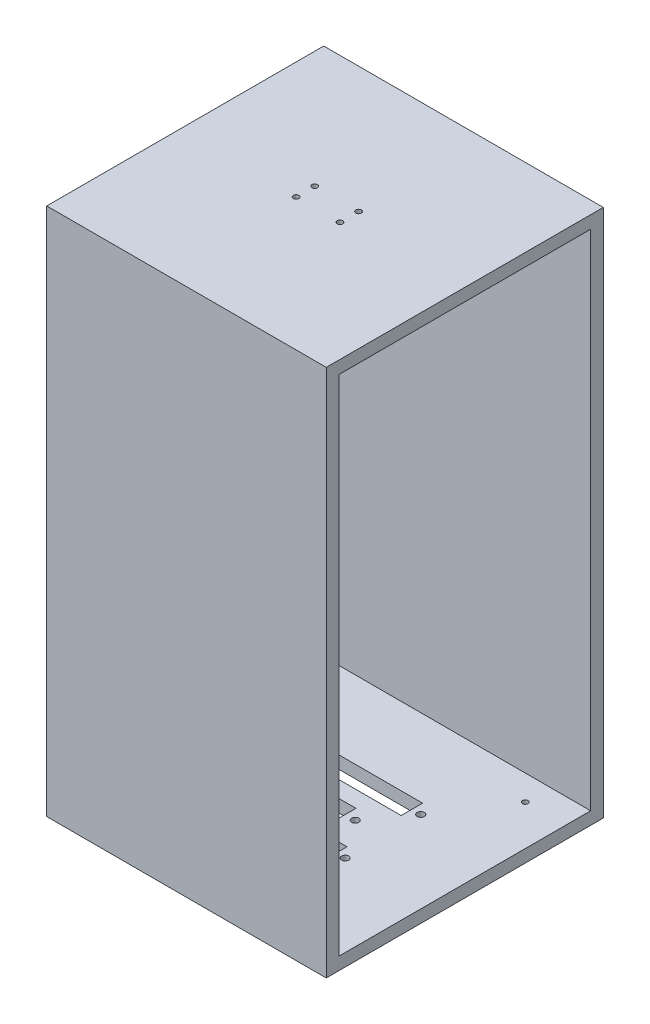
from build123d import *

# Parameters (mm, degrees)
SKETCH1_W             = 111
SKETCH1_H             = 110
MAIN_BODY_DEPTH       = 210
HOLLOW_INSIDE_T       = -5
MAIN_PCB_HOLES_REACH  = 226.19
SKETCH2_R             = 1.1
LED_PCB_HOLES_REACH   = 226.19
SKETCH3_R             = 1.1
CONNECTOR_SLOTS_REACH = 226.19
SKETCH4_R             = 1.4224
SKETCH4_W             = 17.1
SKETCH4_H             = 8.5
SKETCH4_W_2           = 40


with BuildPart() as part:
    # Sketch1 → Main-Body (new body)
    with BuildSketch(Plane(origin=(0, 0, 0), x_dir=(1, 0, 0), z_dir=(0, 1, 0))):
        with Locations((0.5, 0)):
            Rectangle(SKETCH1_W, SKETCH1_H)
    extrude(amount=MAIN_BODY_DEPTH)

    # Hollow-Inside
    hollow_inside_openings = [part.faces().sort_by_distance(p)[0] for p in [
        (56, 105, 0),
    ]]
    offset(amount=HOLLOW_INSIDE_T, openings=hollow_inside_openings, kind=Kind.INTERSECTION)

    # Sketch2 → Main-PCB-Holes (cut, up to next)
    with BuildSketch(Plane.XZ, mode=Mode.PRIVATE) as main_pcb_holes_sk1:
        with Locations((-40, 40)):
            Circle(SKETCH2_R)
    main_pcb_holes_tool1 = extrude(main_pcb_holes_sk1.sketch, amount=-MAIN_PCB_HOLES_REACH, mode=Mode.PRIVATE) & part.part
    # Sketch2 → Main-PCB-Holes (cut, up to next)
    with BuildSketch(Plane.XZ, mode=Mode.PRIVATE) as main_pcb_holes_sk2:
        with Locations((40, 40)):
            Circle(SKETCH2_R)
    main_pcb_holes_tool2 = extrude(main_pcb_holes_sk2.sketch, amount=-MAIN_PCB_HOLES_REACH, mode=Mode.PRIVATE) & part.part
    # Sketch2 → Main-PCB-Holes (cut, up to next)
    with BuildSketch(Plane.XZ, mode=Mode.PRIVATE) as main_pcb_holes_sk3:
        with Locations((40, -40)):
            Circle(SKETCH2_R)
    main_pcb_holes_tool3 = extrude(main_pcb_holes_sk3.sketch, amount=-MAIN_PCB_HOLES_REACH, mode=Mode.PRIVATE) & part.part
    # Sketch2 → Main-PCB-Holes (cut, up to next)
    with BuildSketch(Plane.XZ, mode=Mode.PRIVATE) as main_pcb_holes_sk4:
        with Locations((-40, -40)):
            Circle(SKETCH2_R)
    main_pcb_holes_tool4 = extrude(main_pcb_holes_sk4.sketch, amount=-MAIN_PCB_HOLES_REACH, mode=Mode.PRIVATE) & part.part
    add(main_pcb_holes_tool1.solids().sort_by_distance((-40, 0, 40))[0], mode=Mode.SUBTRACT)
    add(main_pcb_holes_tool2.solids().sort_by_distance((40, 0, 40))[0], mode=Mode.SUBTRACT)
    add(main_pcb_holes_tool3.solids().sort_by_distance((40, 0, -40))[0], mode=Mode.SUBTRACT)
    add(main_pcb_holes_tool4.solids().sort_by_distance((-40, 0, -40))[0], mode=Mode.SUBTRACT)

    # Sketch3 → LED-PCB-Holes (cut, up to next)
    with BuildSketch(Plane(origin=(0, 210, 0), x_dir=(1, 0, 0), z_dir=(0, 1, 0)), mode=Mode.PRIVATE) as led_pcb_holes_sk1:
        with Locations((-8.58, 5)):
            Circle(SKETCH3_R)
    led_pcb_holes_tool1 = extrude(led_pcb_holes_sk1.sketch, amount=-LED_PCB_HOLES_REACH, mode=Mode.PRIVATE) & part.part
    # Sketch3 → LED-PCB-Holes (cut, up to next)
    with BuildSketch(Plane(origin=(0, 210, 0), x_dir=(1, 0, 0), z_dir=(0, 1, 0)), mode=Mode.PRIVATE) as led_pcb_holes_sk2:
        with Locations((8.829, 5)):
            Circle(SKETCH3_R)
    led_pcb_holes_tool2 = extrude(led_pcb_holes_sk2.sketch, amount=-LED_PCB_HOLES_REACH, mode=Mode.PRIVATE) & part.part
    # Sketch3 → LED-PCB-Holes (cut, up to next)
    with BuildSketch(Plane(origin=(0, 210, 0), x_dir=(1, 0, 0), z_dir=(0, 1, 0)), mode=Mode.PRIVATE) as led_pcb_holes_sk3:
        with Locations((8.829, -2.4)):
            Circle(SKETCH3_R)
    led_pcb_holes_tool3 = extrude(led_pcb_holes_sk3.sketch, amount=-LED_PCB_HOLES_REACH, mode=Mode.PRIVATE) & part.part
    # Sketch3 → LED-PCB-Holes (cut, up to next)
    with BuildSketch(Plane(origin=(0, 210, 0), x_dir=(1, 0, 0), z_dir=(0, 1, 0)), mode=Mode.PRIVATE) as led_pcb_holes_sk4:
        with Locations((-8.58, -2.4)):
            Circle(SKETCH3_R)
    led_pcb_holes_tool4 = extrude(led_pcb_holes_sk4.sketch, amount=-LED_PCB_HOLES_REACH, mode=Mode.PRIVATE) & part.part
    add(led_pcb_holes_tool1.solids().sort_by_distance((-8.58, 210, -5))[0], mode=Mode.SUBTRACT)
    add(led_pcb_holes_tool2.solids().sort_by_distance((8.829, 210, -5))[0], mode=Mode.SUBTRACT)
    add(led_pcb_holes_tool3.solids().sort_by_distance((8.829, 210, 2.4))[0], mode=Mode.SUBTRACT)
    add(led_pcb_holes_tool4.solids().sort_by_distance((-8.58, 210, 2.4))[0], mode=Mode.SUBTRACT)

    # Sketch4 → Connector-Slots (cut, up to next)
    with BuildSketch(Plane.XZ, mode=Mode.PRIVATE) as connector_slots_sk1:
        with Locations((-12.4968, 0)):
            Circle(SKETCH4_R)
    connector_slots_tool1 = extrude(connector_slots_sk1.sketch, amount=-CONNECTOR_SLOTS_REACH, mode=Mode.PRIVATE) & part.part
    # Sketch4 → Connector-Slots (cut, up to next)
    with BuildSketch(Plane.XZ, mode=Mode.PRIVATE) as connector_slots_sk2:
        with Locations((12.4968, 0)):
            Circle(SKETCH4_R)
    connector_slots_tool2 = extrude(connector_slots_sk2.sketch, amount=-CONNECTOR_SLOTS_REACH, mode=Mode.PRIVATE) & part.part
    # Sketch4 → Connector-Slots (cut, up to next)
    with BuildSketch(Plane.XZ, mode=Mode.PRIVATE) as connector_slots_sk3:
        with Locations((-23.52, -15)):
            Circle(SKETCH4_R)
    connector_slots_tool3 = extrude(connector_slots_sk3.sketch, amount=-CONNECTOR_SLOTS_REACH, mode=Mode.PRIVATE) & part.part
    # Sketch4 → Connector-Slots (cut, up to next)
    with BuildSketch(Plane.XZ, mode=Mode.PRIVATE) as connector_slots_sk4:
        with Locations((23.52, -15)):
            Circle(SKETCH4_R)
    connector_slots_tool4 = extrude(connector_slots_sk4.sketch, amount=-CONNECTOR_SLOTS_REACH, mode=Mode.PRIVATE) & part.part
    # Sketch4 → Connector-Slots (cut, up to next)
    with BuildSketch(Plane.XZ, mode=Mode.PRIVATE) as connector_slots_sk5:
        with Locations((-23.52, 15)):
            Circle(SKETCH4_R)
    connector_slots_tool5 = extrude(connector_slots_sk5.sketch, amount=-CONNECTOR_SLOTS_REACH, mode=Mode.PRIVATE) & part.part
    # Sketch4 → Connector-Slots (cut, up to next)
    with BuildSketch(Plane.XZ, mode=Mode.PRIVATE) as connector_slots_sk6:
        with Locations((23.52, 15)):
            Circle(SKETCH4_R)
    connector_slots_tool6 = extrude(connector_slots_sk6.sketch, amount=-CONNECTOR_SLOTS_REACH, mode=Mode.PRIVATE) & part.part
    # Sketch4 → Connector-Slots (cut, up to next)
    with BuildSketch(Plane.XZ, mode=Mode.PRIVATE) as connector_slots_sk7:
        Rectangle(SKETCH4_W, SKETCH4_H)
    connector_slots_tool7 = extrude(connector_slots_sk7.sketch, amount=-CONNECTOR_SLOTS_REACH, mode=Mode.PRIVATE) & part.part
    # Sketch4 → Connector-Slots (cut, up to next)
    with BuildSketch(Plane.XZ, mode=Mode.PRIVATE) as connector_slots_sk8:
        with Locations((0, -15)):
            Rectangle(SKETCH4_W_2, SKETCH4_H)
    connector_slots_tool8 = extrude(connector_slots_sk8.sketch, amount=-CONNECTOR_SLOTS_REACH, mode=Mode.PRIVATE) & part.part
    # Sketch4 → Connector-Slots (cut, up to next)
    with BuildSketch(Plane.XZ, mode=Mode.PRIVATE) as connector_slots_sk9:
        with Locations((0, 15)):
            Rectangle(SKETCH4_W_2, SKETCH4_H)
    connector_slots_tool9 = extrude(connector_slots_sk9.sketch, amount=-CONNECTOR_SLOTS_REACH, mode=Mode.PRIVATE) & part.part
    add(connector_slots_tool1.solids().sort_by_distance((-12.4968, 0, 0))[0], mode=Mode.SUBTRACT)
    add(connector_slots_tool2.solids().sort_by_distance((12.4968, 0, 0))[0], mode=Mode.SUBTRACT)
    add(connector_slots_tool3.solids().sort_by_distance((-23.52, 0, -15))[0], mode=Mode.SUBTRACT)
    add(connector_slots_tool4.solids().sort_by_distance((23.52, 0, -15))[0], mode=Mode.SUBTRACT)
    add(connector_slots_tool5.solids().sort_by_distance((-23.52, 0, 15))[0], mode=Mode.SUBTRACT)
    add(connector_slots_tool6.solids().sort_by_distance((23.52, 0, 15))[0], mode=Mode.SUBTRACT)
    add(connector_slots_tool7.solids().sort_by_distance((0, 0, 0))[0], mode=Mode.SUBTRACT)
    add(connector_slots_tool8.solids().sort_by_distance((0, 0, -15))[0], mode=Mode.SUBTRACT)
    add(connector_slots_tool9.solids().sort_by_distance((0, 0, 15))[0], mode=Mode.SUBTRACT)


solid = part.part
